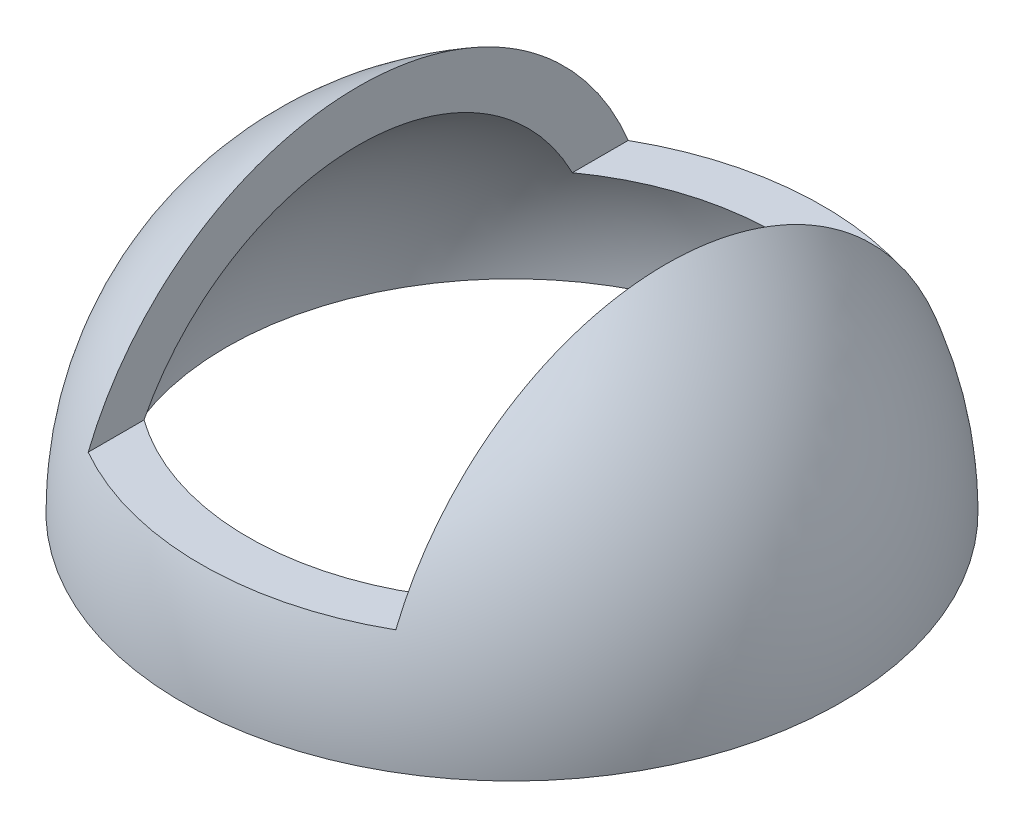
from build123d import *

# Parameters (mm, degrees)
SKETCH2_W          = 17.78
SKETCH2_H          = 16.418842622
CUT_EXTRUDE1_DEPTH = 63.5


with BuildPart() as part:
    # Sketch1 → Revolve1 (revolve)
    with BuildSketch(Plane.XY):
        with BuildLine():
            Line((19.05, 0), (16.51, 0))
            ThreePointArc((16.51, 0), (11.674332957, 11.674332957), (0, 16.51))
            Line((0, 16.51), (0, 19.05))
            ThreePointArc((0, 19.05), (13.470384182, 13.470384182), (19.05, 0))
        make_face()
    revolve(axis=Axis((0, 19.05, 0), (0, -1, 0)))

    # Sketch2 → Cut-Extrude1 (cut, symmetric)
    with BuildSketch(Plane.XY):
        with Locations((0, 14.559421311)):
            Rectangle(SKETCH2_W, SKETCH2_H)
    extrude(amount=CUT_EXTRUDE1_DEPTH, both=True, mode=Mode.SUBTRACT)


solid = part.part
